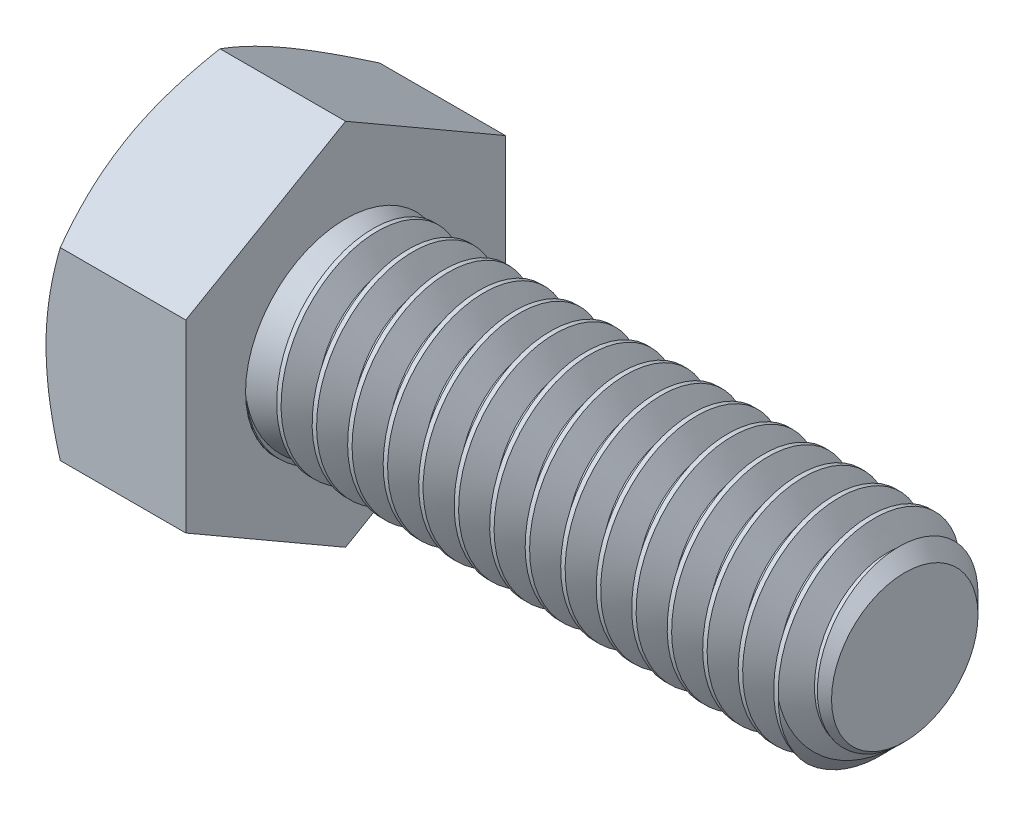
from build123d import *

# Parameters (mm, degrees)
SKETCH5_R           = 3.96875
BOSS_EXTRUDE3_DEPTH = 22.225
CHAMFER1_SIZE       = 1.058333333
BOSS_EXTRUDE4_DEPTH = 5.55625
SKETCH8_OUTSIDE_W   = 126.876
SKETCH8_OUTSIDE_H   = 128.84
SKETCH8_OUTSIDE_R   = 6.35
CUT_EXTRUDE3_DEPTH  = 30.425901599
CUT_EXTRUDE3_DRAFT  = -60
CUT_EXTRUDE4_DEPTH  = 0.254
CIRPATTERN1_COUNT   = 6
CUT_SWEEP1_PITCH    = 1.411111111


with BuildPart() as part:
    # Sketch5 → Boss-Extrude3 (new body)
    with BuildSketch(Plane(origin=(13.890625, 0, 0), x_dir=(0, 0, -1), z_dir=(1, 0, 0))):
        Circle(SKETCH5_R)
    extrude(amount=-BOSS_EXTRUDE3_DEPTH)

    # Chamfer1
    chamfer1_edges = [part.edges().sort_by_distance(p)[0] for p in [
        (13.890625, 0, 3.96875),
    ]]
    chamfer(chamfer1_edges, length=CHAMFER1_SIZE)

    # Cut-Sweep1: the profile of Sketch10 profile screwed along a right-hand helix of 16.75 turns, 8 arcs to a turn; built about Z, then put on its axis
    cut_sweep1_z = Axis((0, 0, 0), (0, 0, 1))
    cut_sweep1_corners = [(3.96905, 0, 0.000173205), (3.052206448, 0, -0.529166667), (3.052206448, 0, -0.705555556), (3.96905, 0, -1.234895427)]
    with BuildLine(mode=Mode.PRIVATE) as cut_sweep1_profile:
        Line(cut_sweep1_corners[0], cut_sweep1_corners[1])
        Line(cut_sweep1_corners[1], cut_sweep1_corners[2])
        Line(cut_sweep1_corners[2], cut_sweep1_corners[3])
        Line(cut_sweep1_corners[3], cut_sweep1_corners[0])
    cut_sweep1_cap = Face(cut_sweep1_profile.wire())
    cut_sweep1_turn_angles = [0, 22.5, 45, 67.5, 90, 112.5, 135, 157.5, 180, 202.5, 225, 247.5, 270, 292.5, 315, 337.5, 360]
    cut_sweep1_turn_weights = [1, 0.9238795325112867, 1, 0.9238795325112867, 1, 0.9238795325112867, 1, 0.9238795325112867, 1, 0.9238795325112867, 1, 0.9238795325112867, 1, 0.9238795325112867, 1, 0.9238795325112867, 1]
    cut_sweep1_turn_rails = [Edge.make_bspline([Vector(p[0], p[1], 0).rotate(cut_sweep1_z, cut_sweep1_turn_angles[k]) / cut_sweep1_turn_weights[k] + Vector(0, 0, p[2] + CUT_SWEEP1_PITCH * cut_sweep1_turn_angles[k] / 360) for k in range(17)], [0, 0, 0, 1, 1, 2, 2, 3, 3, 4, 4, 5, 5, 6, 6, 7, 7, 8, 8, 8], 2, cut_sweep1_turn_weights) for p in cut_sweep1_corners]
    cut_sweep1_turn_sides = [Face.make_surface_from_curves(cut_sweep1_turn_rails[p[0]], cut_sweep1_turn_rails[p[1]]) for p in [(0, 1), (1, 2), (2, 3), (3, 0)]]
    cut_sweep1_last_angles = [5760, 5782.5, 5805, 5827.5, 5850, 5872.5, 5895, 5917.5, 5940, 5962.5, 5985, 6007.5, 6030]
    cut_sweep1_last_weights = [1, 0.9238795325112867, 1, 0.9238795325112867, 1, 0.9238795325112867, 1, 0.9238795325112867, 1, 0.9238795325112867, 1, 0.9238795325111319, 1]
    cut_sweep1_last_rails = [Edge.make_bspline([Vector(p[0], p[1], 0).rotate(cut_sweep1_z, cut_sweep1_last_angles[k]) / cut_sweep1_last_weights[k] + Vector(0, 0, p[2] + CUT_SWEEP1_PITCH * cut_sweep1_last_angles[k] / 360) for k in range(13)], [0, 0, 0, 1, 1, 2, 2, 3, 3, 4, 4, 5, 5, 6, 6, 6], 2, cut_sweep1_last_weights) for p in cut_sweep1_corners]
    cut_sweep1_last_sides = [Face.make_surface_from_curves(cut_sweep1_last_rails[p[0]], cut_sweep1_last_rails[p[1]]) for p in [(0, 1), (1, 2), (2, 3), (3, 0)]]
    cut_sweep1 = Plane(origin=(13.890625, 0, 0), x_dir=(0, 1, 0), z_dir=(-1, 0, 0)) * Solid(Shell([*[p.moved(Location((0, 0, CUT_SWEEP1_PITCH * i))) for i in range(16) for p in cut_sweep1_turn_sides], *cut_sweep1_last_sides, cut_sweep1_cap, cut_sweep1_cap.rotate(cut_sweep1_z, 6030).moved(Location((0, 0, CUT_SWEEP1_PITCH * 6030 / 360)))]))
    add(cut_sweep1, mode=Mode.SUBTRACT)



with BuildPart() as body_2:
    # Sketch6 → Boss-Extrude4 (new body)
    with BuildSketch(Plane.ZY.offset(8.334375)):
        Polygon((6.35, 3.666174209), (0, 7.332348419), (-6.35, 3.666174209), (-6.35, -3.666174209), (0, -7.332348419), (6.35, -3.666174209), align=None)
    extrude(amount=BOSS_EXTRUDE4_DEPTH)


with BuildPart() as cut_extrude3_tool:
    # Sketch8 outside → Cut-Extrude3 (with draft: the straight prism first)
    with BuildSketch(Plane.ZY.offset(13.890625)):
        Rectangle(SKETCH8_OUTSIDE_W, SKETCH8_OUTSIDE_H)
        Circle(SKETCH8_OUTSIDE_R, mode=Mode.SUBTRACT)
    extrude(amount=-CUT_EXTRUDE3_DEPTH)
    # Cut-Extrude3: the draft: its side faces are tilted about the plane it starts from
    cut_extrude3_sides = [cut_extrude3_tool.faces().sort_by_distance(p)[0] for p in [
        (1.322325799, -64.42, 0),
        (1.322325799, 0, 63.438),
        (1.322325799, 64.42, 0),
        (1.322325799, 0, -63.438),
        (1.322325799, 0, -6.35),
    ]]
    draft(cut_extrude3_sides, Plane.ZY.offset(13.890625), CUT_EXTRUDE3_DRAFT)


with BuildPart() as body_2_1:
    add(body_2.part)

    # Cut-Extrude3: cut by cut_extrude3_tool
    add(cut_extrude3_tool.part, mode=Mode.SUBTRACT)

    # Sketch12 → Cut-Extrude4 (cut)
    with BuildSketch(Plane.ZY.offset(13.890625)):
        with BuildLine():
            Line((0.1905, 4.8895), (0.1905, 2.7305))
            ThreePointArc((0.1905, 2.7305), (0, 2.54), (-0.1905, 2.7305))
            Line((-0.1905, 2.7305), (-0.1905, 4.8895))
            ThreePointArc((-0.1905, 4.8895), (0, 5.08), (0.1905, 4.8895))
        make_face()
    cut_extrude4 = extrude(amount=-CUT_EXTRUDE4_DEPTH, mode=Mode.SUBTRACT)

    # CirPattern1: Cut-Extrude4 ×6 about axis
    cirpattern1_axis = Axis((0, 0, 0), (1, 0, 0))
    for i in range(1, CIRPATTERN1_COUNT):
        add(cut_extrude4.rotate(cirpattern1_axis, i * 360 / CIRPATTERN1_COUNT), mode=Mode.SUBTRACT)


with BuildPart() as part_1:
    add(part.part)

    add(body_2_1.part)  # Revolve7 merges body 2
    # Sketch13 → Revolve7 (revolve)
    with BuildSketch(Plane.XY, mode=Mode.PRIVATE) as revolve7_sk:
        Polygon((-8.588375, 0), (-1.449519805, 0), (-8.334375, 3.974973), (-8.588375, 3.974973), align=None)
    revolve(revolve7_sk.sketch.rotate(Axis((-8.588375, 0, 0), (1, 0, 0)), 90), axis=Axis((-8.588375, 0, 0), (1, 0, 0)))


solid = part_1.part
